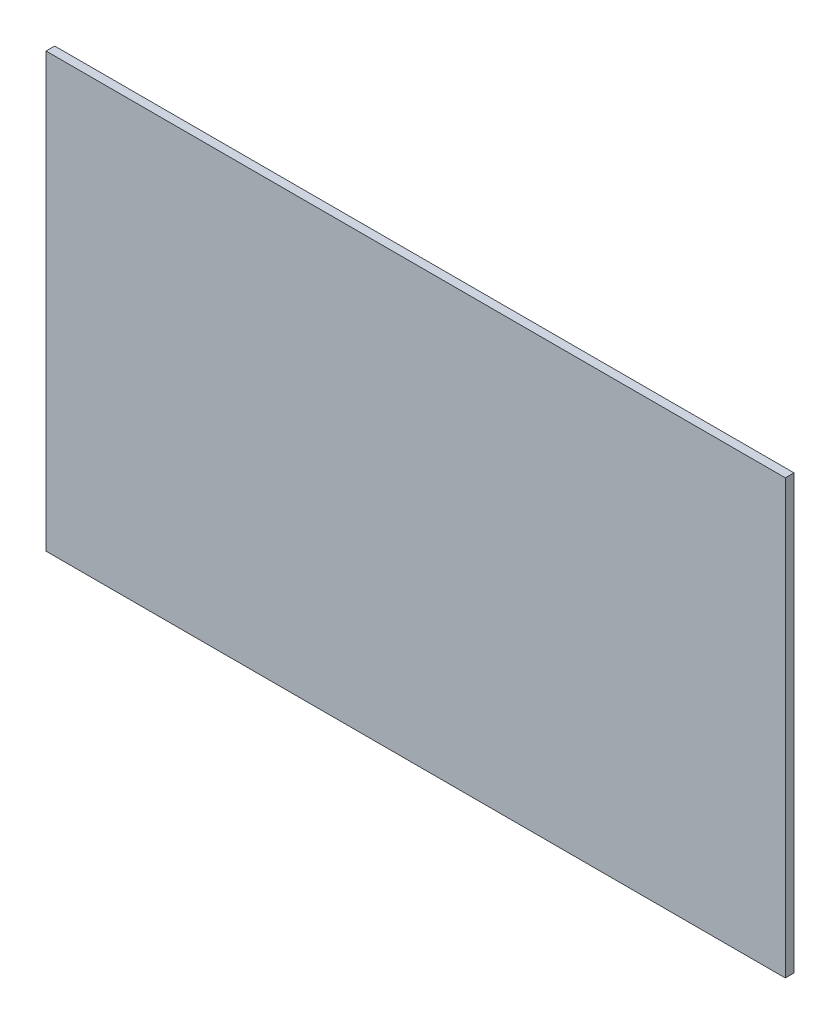
from build123d import *

# Parameters (mm, degrees)
SKETCH1_W           = 256
SKETCH1_H           = 150
BOSS_EXTRUDE1_DEPTH = 3


with BuildPart() as part:
    # Sketch1 → Boss-Extrude1 (new body)
    with BuildSketch(Plane.XY):
        Rectangle(SKETCH1_W, SKETCH1_H)
    extrude(amount=BOSS_EXTRUDE1_DEPTH)


solid = part.part
